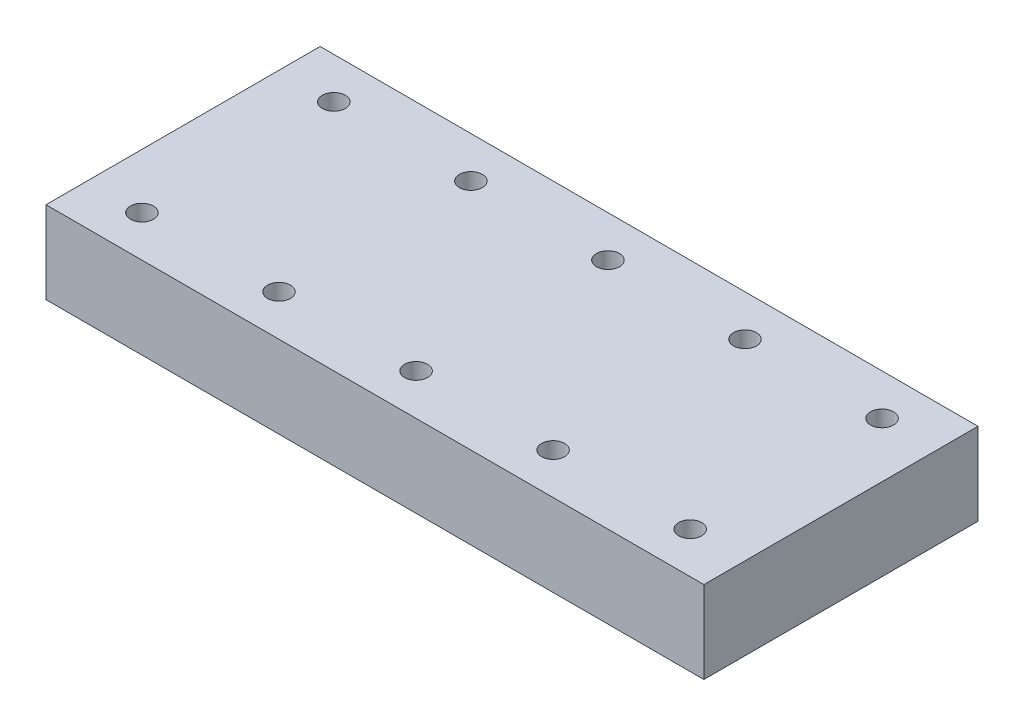
from build123d import *

# Parameters (mm, degrees)
SKETCH2_W                       = 120
SKETCH2_H                       = 50
BOSS_EXTRUDE1_DEPTH             = 15
SKIZZE7_R                       = 1.5
SCHNITT_LINEAR_AUSTRAGEN6_DEPTH = 10
SKIZZE10_W                      = 12.5
SKIZZE10_H                      = 2.5
ROTATION3_ANGLE                 = 180
SKIZZE11_W                      = 12.5
SKIZZE11_H                      = 2.5
ROTATION4_ANGLE                 = 180
SKIZZE12_R                      = 2.1
SCHNITT_LINEAR_AUSTRAGEN7_DEPTH = 83.233536557
FILLET2_R                       = 1
FILLET3_R                       = 1
FILLET4_R                       = 1
FILLET5_R                       = 1
FILLET6_R                       = 1


with BuildPart() as part:
    # Sketch2 → Boss-Extrude1 (new body)
    with BuildSketch(Plane(origin=(0, 0, 0), x_dir=(1, 0, 0), z_dir=(0, 1, 0))):
        with Locations((13.101876656, 9.54663752)):
            Rectangle(SKETCH2_W, SKETCH2_H)
    extrude(amount=BOSS_EXTRUDE1_DEPTH)

    # Skizze7 → Schnitt-Linear austragen6 (cut)
    with BuildSketch(Plane.ZY.offset(46.898123344)):
        with Locations((-9.54663752, 2.5)):
            Circle(SKIZZE7_R)
    extrude(amount=-SCHNITT_LINEAR_AUSTRAGEN6_DEPTH, mode=Mode.SUBTRACT)

    # Sketch3 → Schnitt-Rotation1 (revolve, cut)
    with BuildSketch(Plane(origin=(0, 0, 0), x_dir=(1, 0, 0), z_dir=(0, 1, 0))):
        Polygon((63.101876656, 9.54663752), (63.101876656, 17.04663752), (3.101876656, 17.04663752), (3.101876656, 19.54663752), (-36.898123344, 19.54663752), (-36.898123344, 9.54663752), align=None)
    revolve(axis=Axis((74.354835368, 0, -9.54663752), (-1, 0, 0)), mode=Mode.SUBTRACT)

    # Skizze10 → Rotation3 (revolve)
    with BuildSketch(Plane.XZ):
        with Locations((46.851876656, -15.79663752)):
            Rectangle(SKIZZE10_W, SKIZZE10_H)
    revolve(axis=Axis((85.744816074, 0, -9.54663752), (1, 0, 0)), revolution_arc=ROTATION3_ANGLE)

    # Skizze11 → Rotation4 (revolve)
    with BuildSketch(Plane.XZ):
        with Locations((21.851876656, -15.79663752)):
            Rectangle(SKIZZE11_W, SKIZZE11_H)
    revolve(axis=Axis((95.037830494, 0, -9.54663752), (1, 0, 0)), revolution_arc=ROTATION4_ANGLE)

    # Skizze12 → Schnitt-Linear austragen7 (cut, through all)
    with BuildSketch(Plane.XZ):
        with Locations((-36.898123344, 7.95336248)):
            Circle(SKIZZE12_R)
        with Locations((13.101876656, 7.95336248)):
            Circle(SKIZZE12_R)
        with Locations((63.101876656, 7.95336248)):
            Circle(SKIZZE12_R)
        with Locations((38.101876656, 7.95336248)):
            Circle(SKIZZE12_R)
        with Locations((-11.898123344, 7.95336248)):
            Circle(SKIZZE12_R)
    schnitt_linear_austragen7 = extrude(amount=-SCHNITT_LINEAR_AUSTRAGEN7_DEPTH, mode=Mode.SUBTRACT)

    # Spiegeln1: Schnitt-Linear austragen7 across plane
    add(schnitt_linear_austragen7.mirror(Plane.XY.offset(-9.54663752)), mode=Mode.SUBTRACT)

    # Fillet2
    fillet2_edges = [part.edges().sort_by_distance(p)[0] for p in [
        (3.101876656, 7.5, -9.54663752),
    ]]
    fillet(fillet2_edges, radius=FILLET2_R)

    # Fillet3
    fillet3_edges = [part.edges().sort_by_distance(p)[0] for p in [
        (15.601876656, 5, -9.54663752),
    ]]
    fillet(fillet3_edges, radius=FILLET3_R)

    # Fillet4
    fillet4_edges = [part.edges().sort_by_distance(p)[0] for p in [
        (28.101876656, 5, -9.54663752),
    ]]
    fillet(fillet4_edges, radius=FILLET4_R)

    # Fillet5
    fillet5_edges = [part.edges().sort_by_distance(p)[0] for p in [
        (40.601876656, 5, -9.54663752),
    ]]
    fillet(fillet5_edges, radius=FILLET5_R)

    # Fillet6
    fillet6_edges = [part.edges().sort_by_distance(p)[0] for p in [
        (53.101876656, 5, -9.54663752),
    ]]
    fillet(fillet6_edges, radius=FILLET6_R)


solid = part.part
